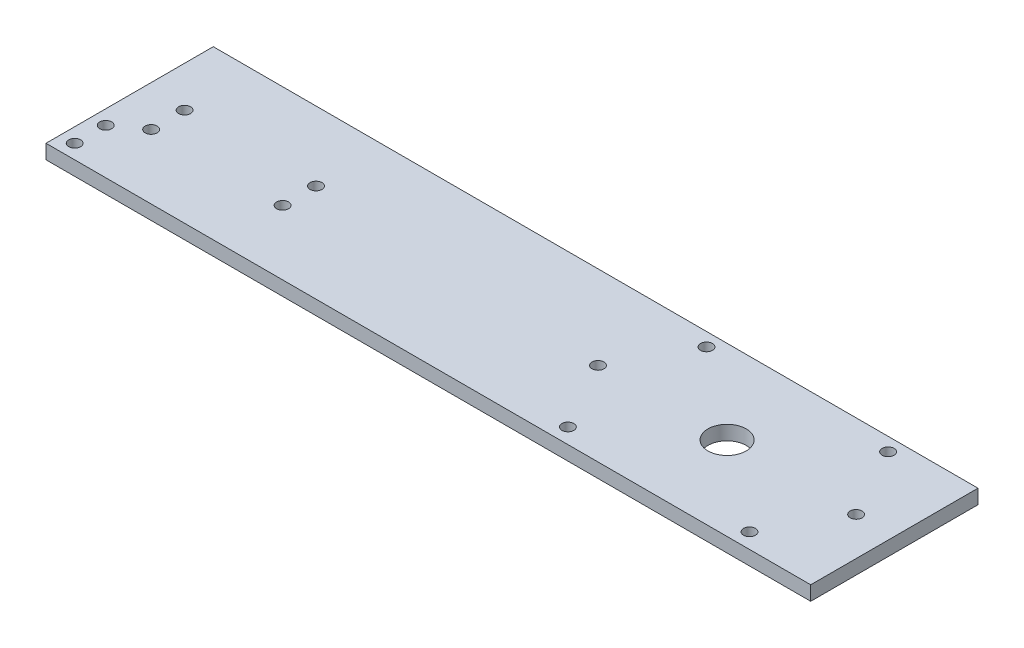
from build123d import *

# Parameters (mm, degrees)
SKETCH1_W           = 160
SKETCH1_H           = 35
SKETCH1_R           = 1.25
SKETCH1_R_2         = 4
BOSS_EXTRUDE1_DEPTH = 3
SKETCH3_R           = 1.25
CUT_EXTRUDE7_DEPTH  = 10


with BuildPart() as part:
    # Sketch1 → Boss-Extrude1 (new body)
    with BuildSketch(Plane(origin=(0, 0, 0), x_dir=(1, 0, 0), z_dir=(0, 1, 0))):
        with Locations((-20, 5)):
            Rectangle(SKETCH1_W, SKETCH1_H)
        with Locations((-97, -9.5)):
            Circle(SKETCH1_R, mode=Mode.SUBTRACT)
        with Locations((-97, -3)):
            Circle(SKETCH1_R, mode=Mode.SUBTRACT)
        with Locations((-91.5, 1)):
            Circle(SKETCH1_R, mode=Mode.SUBTRACT)
        with Locations((-64, 1)):
            Circle(SKETCH1_R, mode=Mode.SUBTRACT)
        with Locations((-91.5, 8)):
            Circle(SKETCH1_R, mode=Mode.SUBTRACT)
        with Locations((-64, 8)):
            Circle(SKETCH1_R, mode=Mode.SUBTRACT)
        with Locations((-2, 5)):
            Circle(SKETCH1_R, mode=Mode.SUBTRACT)
        with Locations((25, 5)):
            Circle(SKETCH1_R_2, mode=Mode.SUBTRACT)
        with Locations((52, 5)):
            Circle(SKETCH1_R, mode=Mode.SUBTRACT)
    extrude(amount=BOSS_EXTRUDE1_DEPTH)

    # Sketch3 → Cut-Extrude7 (cut)
    with BuildSketch(Plane(origin=(0, 3, 0), x_dir=(-1, 0, 0), z_dir=(0, -1, 0))):
        with Locations((-44, -9.307637977)):
            Circle(SKETCH3_R)
        with Locations((-6, -9.307637977)):
            Circle(SKETCH3_R)
        with Locations((-6, 19.692362023)):
            Circle(SKETCH3_R)
        with Locations((-44, 19.692362023)):
            Circle(SKETCH3_R)
    extrude(amount=CUT_EXTRUDE7_DEPTH, mode=Mode.SUBTRACT)


solid = part.part
